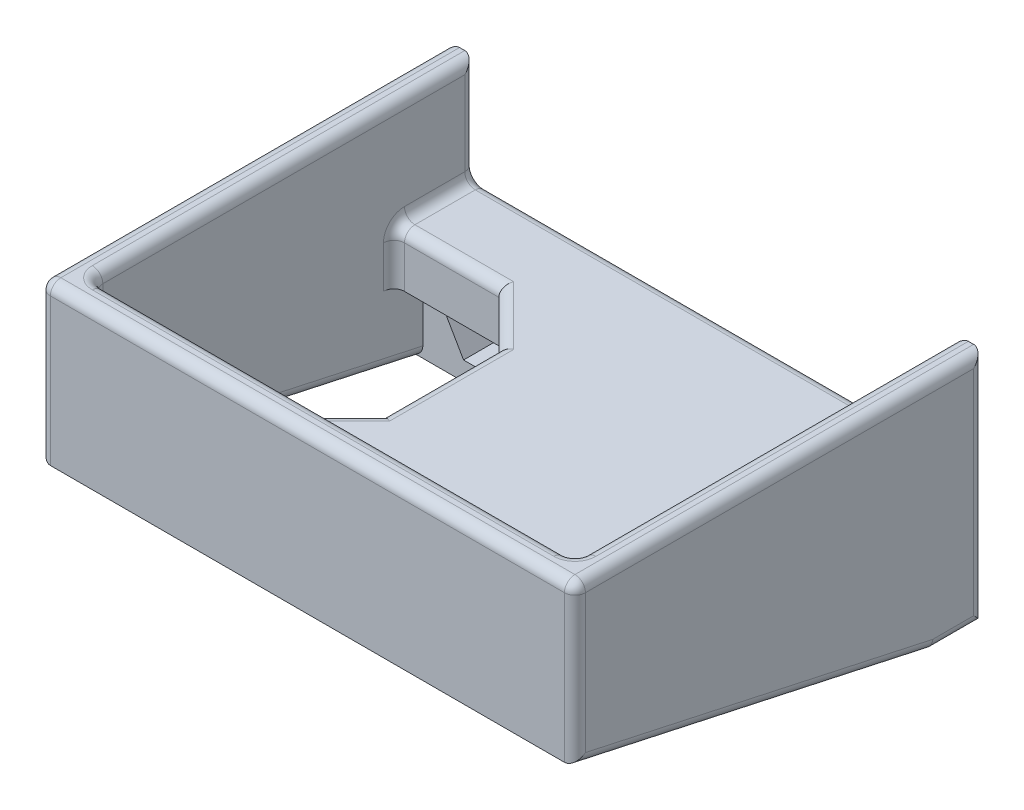
from build123d import *

# Parameters (mm, degrees)
BOSS_EXTRUDE1_DEPTH     = 7.5
BOSS_EXTRUDE2_START     = -7.5
SKETCH1_3_W             = 46
SKETCH1_3_H             = 36.5
BOSS_EXTRUDE2_DEPTH     = 5
BOSS_EXTRUDE3_DEPTH     = 2.5
BOSS_EXTRUDE4_DEPTH     = 5
CUT_EXTRUDE1_START      = -5
CUT_EXTRUDE1_DEPTH      = 3
M2_5_CLEARANCE_HOLE1_D  = 2.9
MIRROR1_START           = -16.25
MIRROR1_DEPTH           = 3
MIRROR1_START_2         = -18.25
MIRROR1_2_DEPTH         = 5
MIRROR1_3_OUTLINE_R     = 1.45
MIRROR1_3_DEPTH         = 2
MIRROR1_START_3         = 23
MIRROR1_4_DEPTH         = 2.5
CUT_EXTRUDE2_DEPTH      = 37.094632565
CUT_EXTRUDE2_DEPTH_BACK = 37.094632565
SKETCH10_W              = 15
SKETCH10_H              = 21
CHAMFER1_SIZE           = 5
FILLET1_R               = 1
FILLET2_R               = 1
FILLET6_R               = 1
FILLET7_R               = 1
FILLET8_R               = 1


with BuildPart() as part:
    # Sketch1 → Boss-Extrude1 (new, symmetric)
    with BuildSketch(Plane(origin=(0, 0, 0), x_dir=(1, 0, 0), z_dir=(0, 1, 0))):
        Polygon((23, -18.25), (-23, -18.25), (-23, 18.25), (-25.5, 18.25), (-25.5, -20.75), (25.5, -20.75), (25.5, 18.25), (23, 18.25), align=None)
    extrude(amount=BOSS_EXTRUDE1_DEPTH, both=True)

    # Sketch1<3> → Boss-Extrude2 (add)
    with BuildSketch(Plane(origin=(0, 0, 0), x_dir=(1, 0, 0), z_dir=(0, 1, 0)).offset(BOSS_EXTRUDE2_START)):
        Rectangle(SKETCH1_3_W, SKETCH1_3_H)
    extrude(amount=BOSS_EXTRUDE2_DEPTH)

    # Sketch5 → Boss-Extrude3 (add)
    with BuildSketch(Plane(origin=(-25.5, 32.25, 0), x_dir=(0, 1, 0), z_dir=(-1, 0, 0))):
        Polygon((-47.15, 18.25), (-39.75, 18.25), (-39.75, -20.75), (-47.15, 13.25), align=None)
    extrude(amount=-BOSS_EXTRUDE3_DEPTH)

    # Sketch6 → Boss-Extrude4 (add)
    with BuildSketch(Plane(origin=(0, 0, -18.25), x_dir=(-1, 0, 0), z_dir=(0, 0, -1))):
        Polygon((-12, -10.3), (-14.266838493, -10.3), (-15.883419246, -13.1), (-19.116580754, -13.1), (-20.733161507, -10.3), (-19.116580754, -7.5), (-23, -7.5), (-23, -14.9), (-12, -14.9), align=None)
        Polygon((23, -7.5), (12, -7.5), (12, -10.3), (12, -14.9), (23, -14.9), align=None)
    extrude(amount=-BOSS_EXTRUDE4_DEPTH)

    # Sketch6<3> → Cut-Extrude1 (cut)
    with BuildSketch(Plane(origin=(0, 0, -18.25), x_dir=(-1, 0, 0), z_dir=(0, 0, -1)).offset(CUT_EXTRUDE1_START)):
        Polygon((19.0011107, -7.7), (15.9988893, -7.7), (14.4977786, -10.3), (15.9988893, -12.9), (19.0011107, -12.9), (20.5022214, -10.3), align=None)
    extrude(amount=CUT_EXTRUDE1_DEPTH, mode=Mode.SUBTRACT)

    # M2.5 Clearance Hole1 (through all)
    with Locations(Plane.XY.offset(-16.25)):
        with Locations((-17.5, -10.3), (17.5, -10.3)):
            Hole(M2_5_CLEARANCE_HOLE1_D / 2)

    # Mirror1: read off the stored shape, not the designer's step
    # Mirror1 outline → Mirror1 (cut)
    with BuildSketch(Plane.XY.offset(MIRROR1_START)):
        Polygon((-14.266838493, -10.3), (-15.883419246, -7.5), (-19.116580754, -7.5), (-20.733161507, -10.3), (-19.116580754, -13.1), (-15.883419246, -13.1), align=None)
        Polygon((-15.9988893, -12.9), (-19.0011107, -12.9), (-20.5022214, -10.3), (-19.0011107, -7.7), (-15.9988893, -7.7), (-14.4977786, -10.3), align=None, mode=Mode.SUBTRACT)
    extrude(amount=MIRROR1_DEPTH, mode=Mode.SUBTRACT)

    # Mirror1 2 outline → Mirror1 2 (add)
    with BuildSketch(Plane.XY.offset(MIRROR1_START_2)):
        Polygon((20.733161507, -10.3), (19.116580754, -7.5), (12, -7.5), (12, -10.3), (14.266838493, -10.3), (15.883419246, -13.1), (19.116580754, -13.1), align=None)
        Polygon((15.9988893, -7.7), (19.0011107, -7.7), (20.5022214, -10.3), (19.0011107, -12.9), (15.9988893, -12.9), (14.4977786, -10.3), align=None, mode=Mode.SUBTRACT)
    extrude(amount=MIRROR1_2_DEPTH)

    # Mirror1 3 outline → Mirror1 3 (add)
    with BuildSketch(Plane.XY.offset(MIRROR1_START_2)):
        Polygon((20.5022214, -10.3), (19.0011107, -7.7), (15.9988893, -7.7), (14.4977786, -10.3), (15.9988893, -12.9), (19.0011107, -12.9), align=None)
        with Locations((17.5, -10.3)):
            Circle(MIRROR1_3_OUTLINE_R, mode=Mode.SUBTRACT)
    extrude(amount=MIRROR1_3_DEPTH)

    # Mirror1 4 outline → Mirror1 4 (add)
    with BuildSketch(Plane.YZ.offset(MIRROR1_START_3)):
        Polygon((-14.9, -13.25), (-14.9, -18.25), (-7.5, -18.25), (-7.5, 20.75), align=None)
    extrude(amount=MIRROR1_4_DEPTH)

    # Sketch10 → Cut-Extrude2 (cut, two sides: drawn at the far end of the back side and taken through both)
    with BuildSketch(Plane(origin=(0, 0, 0), x_dir=(1, 0, 0), z_dir=(0, 1, 0)).offset(-CUT_EXTRUDE2_DEPTH_BACK)):
        with Locations((-15.5, 0)):
            Rectangle(SKETCH10_W, SKETCH10_H)
    extrude(amount=CUT_EXTRUDE2_DEPTH + CUT_EXTRUDE2_DEPTH_BACK, mode=Mode.SUBTRACT)

    # Chamfer1
    chamfer1_edges = [part.edges().sort_by_distance(p)[0] for p in [
        (-8, -5, -10.5),
        (-8, -5, 10.5),
    ]]
    chamfer(chamfer1_edges, length=CHAMFER1_SIZE)

    # Fillet1
    fillet1_edges = [part.edges().sort_by_distance(p)[0] for p in [
        (23, 7.5, 0),
        (-23, 2.5, -18.25),
        (-23, 2.5, 18.25),
        (23, 2.5, 18.25),
        (23, 2.5, -18.25),
        (0, 7.5, 18.25),
        (-23, 7.5, 0),
        (-23, -2.5, -14.375),
        (-18, -2.5, -10.5),
        (-23, -5, -10.5),
        (-23, -5, 10.5),
        (-8, -2.5, 0),
        (-18, -2.5, 10.5),
        (-23, -2.5, 14.375),
        (-10.5, -2.5, 8),
        (-10.5, -2.5, -8),
        (0, -2.5, -18.25),
        (0, -2.5, 18.25),
        (23, -2.5, 0),
    ]]
    fillet(fillet1_edges, radius=FILLET1_R)

    # Fillet2
    fillet2_edges = [part.edges().sort_by_distance(p)[0] for p in [
        (25.5, -14.9, -15.75),
        (25.5, -11.2, 3.75),
        (25.5, 0, 20.75),
        (-25.5, 0, 20.75),
        (-25.5, -3.7, -18.25),
        (25.5, -3.7, -18.25),
        (-25.5, 7.5, 1.25),
        (-25.5, -14.9, -15.75),
        (-25.5, -11.2, 3.75),
        (25.5, 7.5, 1.25),
    ]]
    fillet(fillet2_edges, radius=FILLET2_R)

    # Fillet6
    fillet6_edges = [part.edges().sort_by_distance(p)[0] for p in [
        (-12, -14.9, -15.75),
        (12, -14.9, -15.75),
        (12, -11.2, -13.25),
    ]]
    fillet(fillet6_edges, radius=FILLET6_R)

    # Fillet7
    # the kernel refuses this fillet: 1 mm, written as the material it takes off along each edge
    with BuildSketch(Plane(origin=(24.5, 6.5, 19.75), x_dir=(0, 0, 1), z_dir=(0, 1, 0))) as fillet7_piece_1_section:
        Polygon((0, 0), (FILLET7_R, 0), (FILLET7_R, FILLET7_R), (0, FILLET7_R), align=None)
    fillet7_piece_1 = extrude(amount=FILLET7_R, mode=Mode.PRIVATE)
    fillet7_piece_1 = fillet7_piece_1 - Plane(origin=(24.5, 6.5, 19.75), x_dir=(-0.7071067811865476, 0, -0.7071067811865475), z_dir=(0, 1, 0)) * Sphere(FILLET7_R, mode=Mode.PRIVATE)
    add(fillet7_piece_1, mode=Mode.SUBTRACT)
    with BuildSketch(Plane(origin=(-24.5, 6.5, 19.75), x_dir=(0, 0, 1), z_dir=(0, 1, 0))) as fillet7_piece_2_section:
        Polygon((0, 0), (FILLET7_R, 0), (FILLET7_R, -FILLET7_R), (0, -FILLET7_R), align=None)
    fillet7_piece_2 = extrude(amount=FILLET7_R, mode=Mode.PRIVATE)
    fillet7_piece_2 = fillet7_piece_2 - Plane(origin=(-24.5, 6.5, 19.75), x_dir=(0.7071067811865475, 0, -0.7071067811865475), z_dir=(0, 1, 0)) * Sphere(FILLET7_R, mode=Mode.PRIVATE)
    add(fillet7_piece_2, mode=Mode.SUBTRACT)
    with BuildSketch(Plane(origin=(-24.5, 7.5, 20.75), x_dir=(0, 0, -1), z_dir=(1, 0, 0))) as fillet7_piece_3:
        with BuildLine():
            CenterArc((FILLET7_R, -FILLET7_R), FILLET7_R, 90, 90)
            Line((0, -FILLET7_R), (0, 0))
            Line((0, 0), (FILLET7_R, 0))
        make_face()
    extrude(amount=49, mode=Mode.SUBTRACT)

    # Fillet8
    fillet8_edges = [part.edges().sort_by_distance(p)[0] for p in [
        (23, -11.2, 3.75),
        (-23, -11.2, 3.75),
    ]]
    fillet(fillet8_edges, radius=FILLET8_R)


solid = part.part
